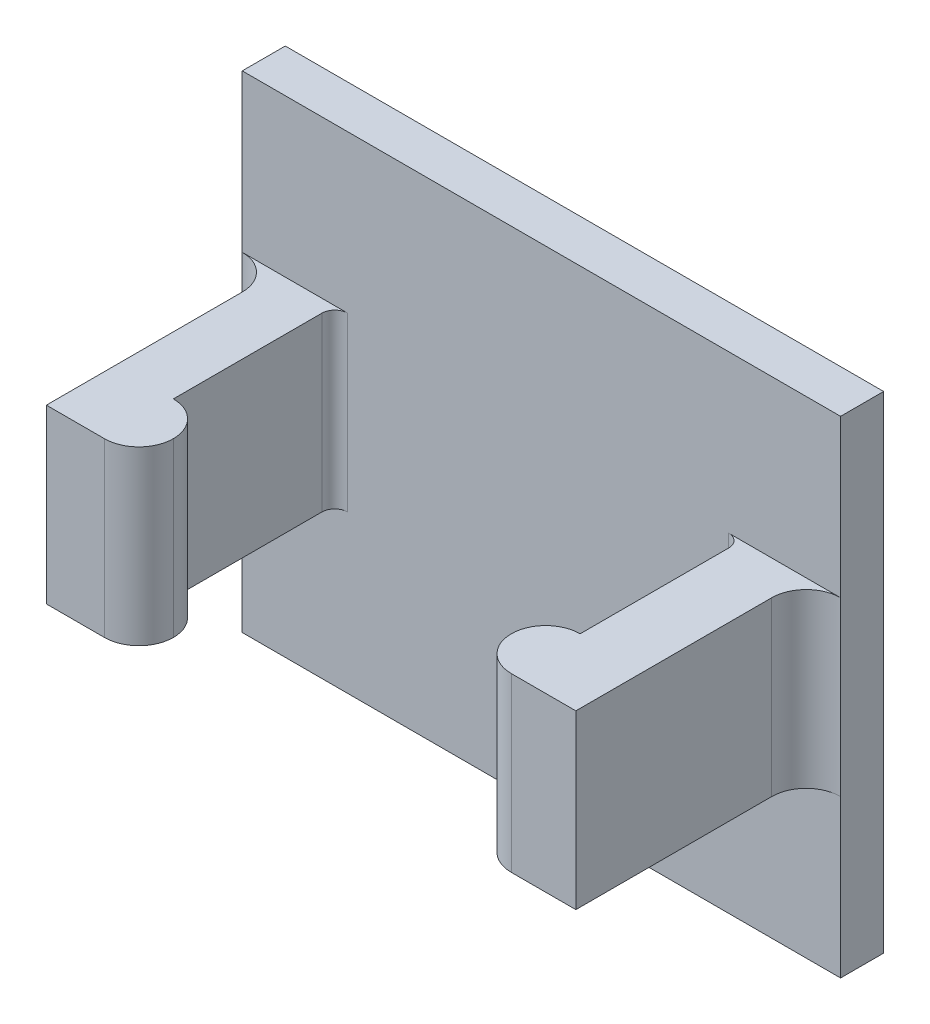
from build123d import *

# Parameters (mm, degrees)
SKETCH_1_W      = 12.3
SKETCH_1_H      = 11.3
EXTRUDE_1_DEPTH = 1
SKETCH_2_W      = 1.35
SKETCH_2_H      = 4
SKETCH_2_W_2    = 1.5
EXTRUDE_2_DEPTH = 5.35
SKETCH_3_W      = 1.6
SKETCH_3_H      = 4
EXTRUDE_3_DEPTH = 0.8
SKETCH_4_W      = 1.6
SKETCH_4_H      = 4
EXTRUDE_4_DEPTH = 0.8
FILLET_1_R      = 0.8
FILLET_2_R      = 0.3
SKETCH_5_W      = 1
SKETCH_5_H      = 11.3
EXTRUDE_5_DEPTH = 0.8
SKETCH_6_W      = 1
SKETCH_6_H      = 11.3
EXTRUDE_6_DEPTH = 0.8
FILLET_3_R      = 0.8


with BuildPart() as part:
    # 스케치1 → 보스-돌출1 (new body)
    with BuildSketch(Plane.XY):
        Rectangle(SKETCH_1_W, SKETCH_1_H)
    extrude(amount=EXTRUDE_1_DEPTH)

    # 스케치2 → 보스-돌출2 (add)
    with BuildSketch(Plane.XY.offset(1)):
        with Locations((-5.475, 0)):
            Rectangle(SKETCH_2_W, SKETCH_2_H)
        with Locations((5.4, 0)):
            Rectangle(SKETCH_2_W_2, SKETCH_2_H)
    extrude(amount=EXTRUDE_2_DEPTH)

    # 스케치3 → 보스-돌출3 (add)
    with BuildSketch(Plane(origin=(-4.8, 0, 0), x_dir=(0, 0, -1), z_dir=(1, 0, 0))):
        with Locations((-5.55, 0)):
            Rectangle(SKETCH_3_W, SKETCH_3_H)
    extrude(amount=EXTRUDE_3_DEPTH)

    # 스케치4 → 보스-돌출4 (add)
    with BuildSketch(Plane.ZY.offset(-4.65)):
        with Locations((5.55, 0)):
            Rectangle(SKETCH_4_W, SKETCH_4_H)
    extrude(amount=EXTRUDE_4_DEPTH)

    # 필렛1
    fillet_1_edges = [part.edges().sort_by_distance(p)[0] for p in [
        (3.85, 0, 6.35),
        (3.85, 0, 4.75),
        (-4, 0, 6.35),
        (-4, 0, 4.75),
    ]]
    fillet(fillet_1_edges, radius=FILLET_1_R - 0.0001)  # a hair under: the kernel refuses the full size

    # 필렛2
    fillet_2_edges = [part.edges().sort_by_distance(p)[0] for p in [
        (-4.8, 0, 1),
        (4.65, 0, 1),
    ]]
    fillet(fillet_2_edges, radius=FILLET_2_R)

    # 스케치5 → 보스-돌출5 (add)
    with BuildSketch(Plane.ZY.offset(6.15)):
        with Locations((0.5, 0)):
            Rectangle(SKETCH_5_W, SKETCH_5_H)
    extrude(amount=EXTRUDE_5_DEPTH)

    # 스케치6 → 보스-돌출6 (add)
    with BuildSketch(Plane(origin=(6.15, 0, 0), x_dir=(0, 0, -1), z_dir=(1, 0, 0))):
        with Locations((-0.5, 0)):
            Rectangle(SKETCH_6_W, SKETCH_6_H)
    extrude(amount=EXTRUDE_6_DEPTH)

    # 필렛3
    fillet_3_edges = [part.edges().sort_by_distance(p)[0] for p in [
        (-6.15, 0, 1),
        (6.15, 0, 1),
    ]]
    fillet(fillet_3_edges, radius=FILLET_3_R - 0.0001)  # a hair under: the kernel refuses the full size


solid = part.part
